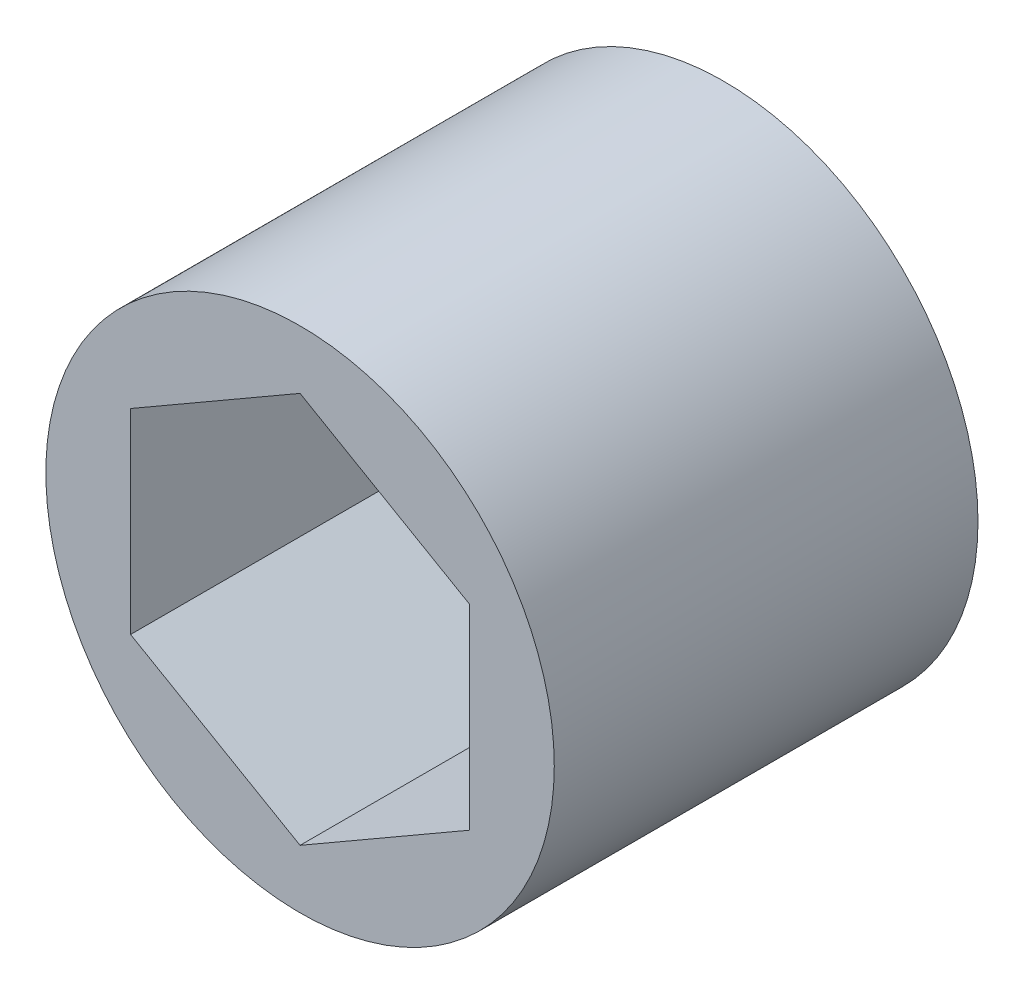
from build123d import *

# Parameters (mm, degrees)
SKETCH1_R           = 9.525
BOSS_EXTRUDE1_DEPTH = 15.875


with BuildPart() as part:
    # Sketch1 → Boss-Extrude1 (new body)
    with BuildSketch(Plane.XY):
        Circle(SKETCH1_R)
        Polygon((0, 7.332348419), (-6.35, 3.666174209), (-6.35, -3.666174209), (0, -7.332348419), (6.35, -3.666174209), (6.35, 3.666174209), align=None, mode=Mode.SUBTRACT)
    extrude(amount=BOSS_EXTRUDE1_DEPTH)


solid = part.part
